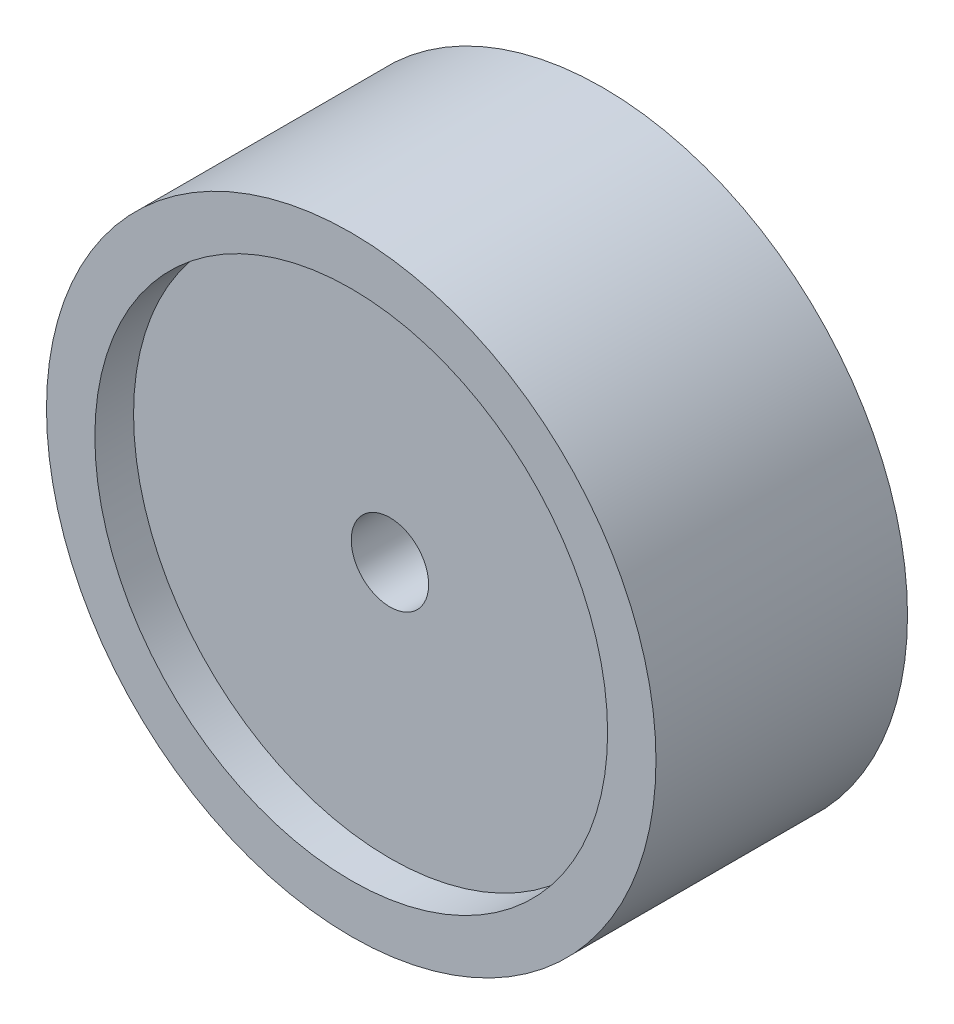
from build123d import *

# Parameters (mm, degrees)
ESQUISSE1_R             = 31.5
BOSS_EXTRU_1_DEPTH      = 26
ESQUISSE2_R             = 4
ENL_V_MAT_EXTRU_1_DEPTH = 52.580034897
ESQUISSE3_R             = 26.5
ENL_V_MAT_EXTRU_2_DEPTH = 4


with BuildPart() as part:
    # Esquisse1 → Boss.-Extru.1 (new body)
    with BuildSketch(Plane.XY):
        Circle(ESQUISSE1_R)
    extrude(amount=BOSS_EXTRU_1_DEPTH)

    # Esquisse2 → Enlèv. mat.-Extru.1 (cut, through all)
    with BuildSketch(Plane.XY.offset(26)):
        Circle(ESQUISSE2_R)
    extrude(amount=-ENL_V_MAT_EXTRU_1_DEPTH, mode=Mode.SUBTRACT)

    # Esquisse3 → Enlèv. mat.-Extru.2 (cut)
    with BuildSketch(Plane.XY.offset(26)):
        Circle(ESQUISSE3_R)
    extrude(amount=-ENL_V_MAT_EXTRU_2_DEPTH, mode=Mode.SUBTRACT)


solid = part.part
